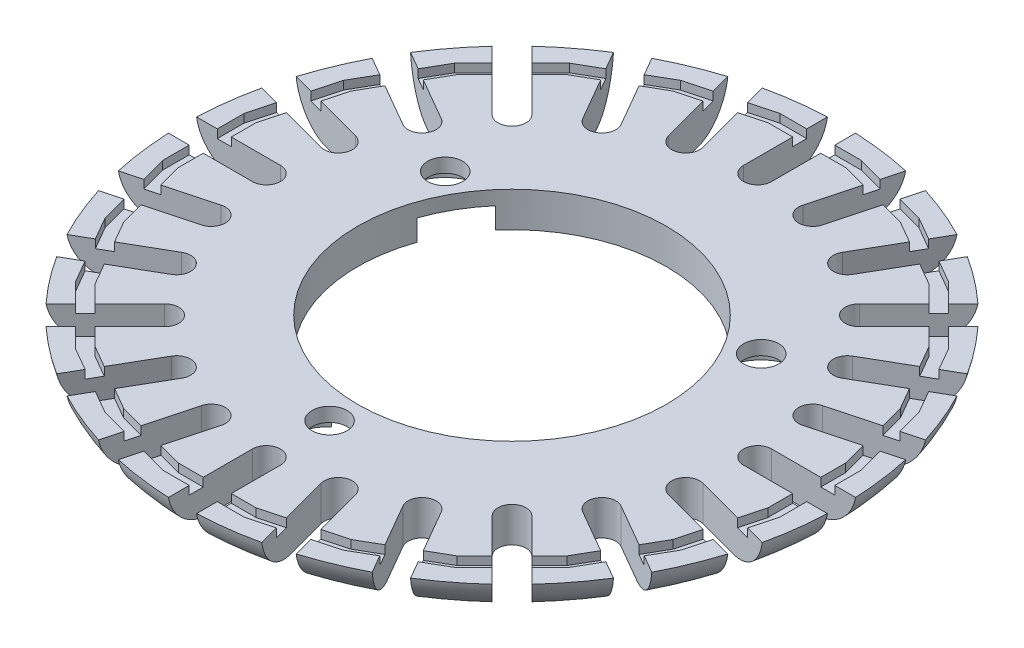
from build123d import *

# Parameters (mm, degrees)
ESBO_O1_R                = 23.5
RESSALTO_EXTRUS_O1_DEPTH = 2.5
FILETE1_R                = 3
CORTE_EXTRUS_O1_DEPTH    = 34.327916234
PADR_OCIRCULAR1_COUNT    = 24
CORTE_EXTRUS_O2_DEPTH    = 0.6
PADR_OCIRCULAR2_COUNT    = 24
ESBO_O5_R                = 11
CORTE_EXTRUS_O3_DEPTH    = 34.29789798
ESBO_O6_R                = 1.25
CORTE_EXTRUS_O5_DEPTH    = 2.5
ESBO_O8_R                = 3
CORTE_EXTRUS_O6_DEPTH    = 1.5


with BuildPart() as part:
    # Esboço1 → Ressalto-extrusão1 (new body)
    with BuildSketch(Plane(origin=(0, 0, 0), x_dir=(1, 0, 0), z_dir=(0, 1, 0))):
        with Locations(Location((0, 0, 0), (0, 0, 270))):
            Circle(ESBO_O1_R)
    extrude(amount=RESSALTO_EXTRUS_O1_DEPTH)

    # Filete1
    # the kernel refuses this fillet: 3 mm, written as the material it takes off along each edge
    with BuildSketch(Plane(origin=(0, 0, 0), x_dir=(0, 0, 1), z_dir=(-1, 0, 0))) as filete1_piece_1:
        with BuildLine():
            CenterArc((20.541960108, 3), FILETE1_R, 270, 80.405931773)
            Line((20.541960108, 0), (20.541960108, -0.06))
            Line((20.541960108, -0.06), (23.5, -0.06))
            Line((23.5, -0.06), (23.56, 0))
            ThreePointArc((23.56, 0), (23.56, 1.25), (23.559160798, 2.49))
            Line((23.559160798, 2.49), (23.5, 2.5))
        make_face()
    revolve(axis=Axis((0, 0, 0), (0, 1, 0)), mode=Mode.SUBTRACT)

    # Esboço2 → Corte-extrusão1 (cut, through all)
    with BuildSketch(Plane(origin=(0, 2.5, 0), x_dir=(1, 0, 0), z_dir=(0, 1, 0))):
        with BuildLine():
            Line((1, 17.5), (1, 23.5))
            Line((1, 23.5), (-1, 23.5))
            Line((-1, 23.5), (-1, 17.5))
            ThreePointArc((-1, 17.5), (0, 16.5), (1, 17.5))
        make_face()
    corte_extrus_o1 = extrude(amount=-CORTE_EXTRUS_O1_DEPTH, mode=Mode.SUBTRACT)

    # PadrãoCircular1: Corte-extrusão1 ×24 about axis
    padr_ocircular1_axis = Axis((0, 0, 0), (0, 1, 0))
    for i in range(1, PADR_OCIRCULAR1_COUNT):
        add(corte_extrus_o1.rotate(padr_ocircular1_axis, i * 360 / PADR_OCIRCULAR1_COUNT), mode=Mode.SUBTRACT)

    # Esboço4 → Corte-extrusão2 (cut)
    with BuildSketch(Plane(origin=(0, 2.5, 0), x_dir=(1, 0, 0), z_dir=(0, 1, 0))):
        Polygon((-2.896354947, 22), (2.896354947, 22), (2.764702449, 21), (-2.764702449, 21), align=None)
    corte_extrus_o2 = extrude(amount=-CORTE_EXTRUS_O2_DEPTH, mode=Mode.SUBTRACT)

    # PadrãoCircular2: Corte-extrusão2 ×24 about axis
    padr_ocircular2_axis = Axis((0, 0, 0), (0, 1, 0))
    for i in range(1, PADR_OCIRCULAR2_COUNT):
        add(corte_extrus_o2.rotate(padr_ocircular2_axis, i * 360 / PADR_OCIRCULAR2_COUNT), mode=Mode.SUBTRACT)

    # Esboço5 → Corte-extrusão3 (cut, through all)
    with BuildSketch(Plane(origin=(0, 2.5, 0), x_dir=(1, 0, 0), z_dir=(0, 1, 0))):
        with Locations(Location((0, 0, 0), (0, 0, 270))):
            Circle(ESBO_O5_R)
    extrude(amount=-CORTE_EXTRUS_O3_DEPTH, mode=Mode.SUBTRACT)

    # Esboço6 → Corte-extrusão5 (cut)
    with BuildSketch(Plane(origin=(0, 2.5, 0), x_dir=(1, 0, 0), z_dir=(0, 1, 0))):
        with Locations(Location((-11.258330249, 6.5, 0), (0, 0, 270))):
            Circle(ESBO_O6_R)
        with Locations(Location((11.258330249, 6.5, 0), (0, 0, 270))):
            Circle(ESBO_O6_R)
        with Locations(Location((0, -13, 0), (0, 0, 270))):
            Circle(ESBO_O6_R)
    extrude(amount=-CORTE_EXTRUS_O5_DEPTH, mode=Mode.SUBTRACT)

    # Esboço8 → Corte-extrusão6 (cut)
    with BuildSketch(Plane(origin=(0, 0, 0), x_dir=(-1, 0, 0), z_dir=(0, -1, 0))):
        with Locations((11.258330249, 6.5)):
            Circle(ESBO_O8_R)
        with Locations((-11.258330249, 6.5)):
            Circle(ESBO_O8_R)
        with Locations((0, -13)):
            Circle(ESBO_O8_R)
    extrude(amount=-CORTE_EXTRUS_O6_DEPTH, mode=Mode.SUBTRACT)


solid = part.part
